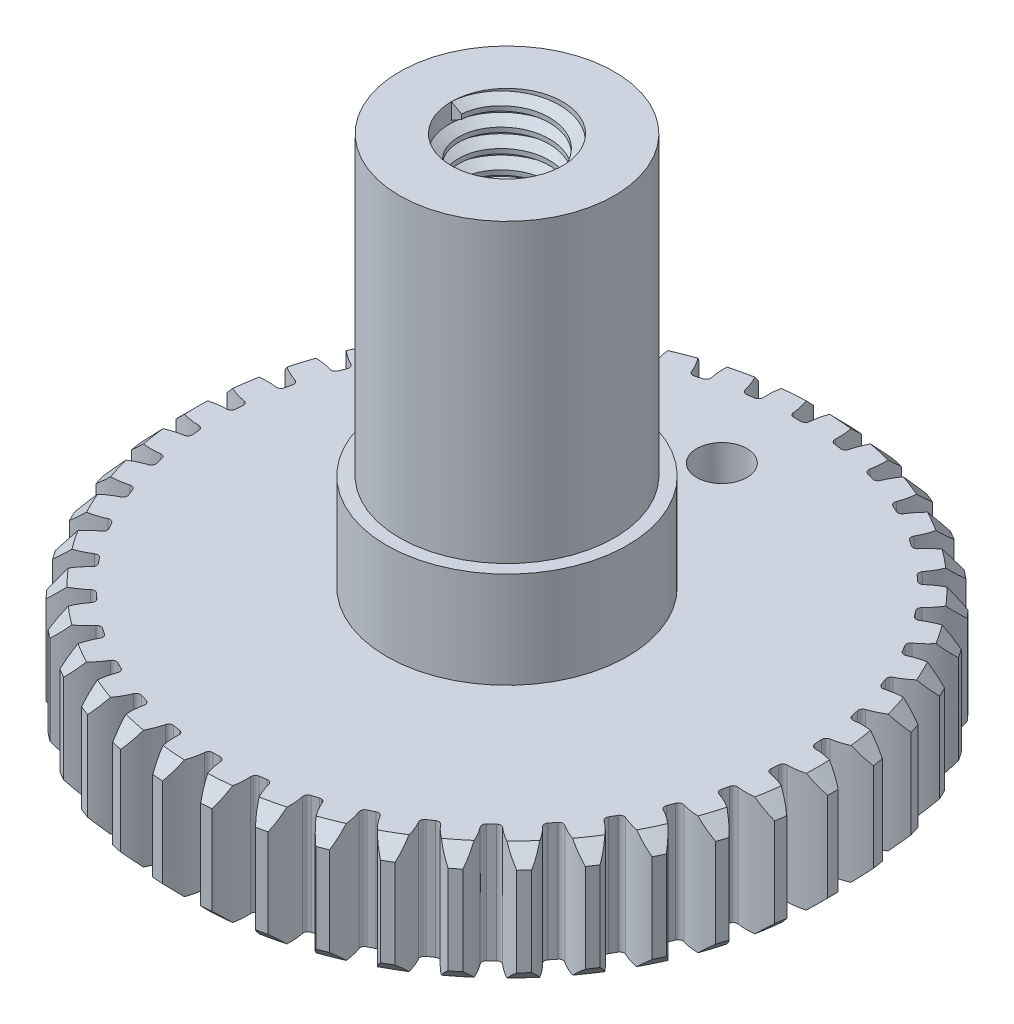
from build123d import *

# Parameters (mm, degrees)
SKETCH1_R                = 8.8
BOSS_EXTRUDE1_DEPTH      = 3.2
CUT_EXTRUDE1_DEPTH       = 13.849902723
FILLET2_R                = 0.12
CHAMFER1_SIZE            = 0.4
CIRPATTERN3_COUNT        = 42
FILLET2_OF_CIRPATTERN3_R = 0.12
SKETCH3_R                = 3.25
BOSS_EXTRUDE2_DEPTH      = 2.6
SKETCH4_R                = 2.9
SKETCH4_R_2              = 1.5
BOSS_EXTRUDE3_DEPTH      = 8
SKETCH5_R                = 6
BOSS_EXTRUDE4_DEPTH      = 0.9
SKETCH6_R                = 5
CUT_EXTRUDE2_DEPTH       = 2.6
SKETCH7_R                = 0.67838193
CUT_EXTRUDE3_DEPTH       = 17.339382575
SKETCH8_W                = 2
SKETCH8_H                = 5.2
CUT_EXTRUDE4_DEPTH       = 3
FILLET4_R                = 0.8
THREAD1_PITCH            = 0.5


with BuildPart() as part:
    # Sketch1 → Boss-Extrude1 (new body)
    with BuildSketch(Plane(origin=(0, 0, 0), x_dir=(1, 0, 0), z_dir=(0, 1, 0))):
        with Locations(Location((0, 0, 0), (0, 0, 270))):
            Circle(SKETCH1_R)
    extrude(amount=BOSS_EXTRUDE1_DEPTH)

    # Sketch2 → Cut-Extrude1 (cut, symmetric)
    with BuildSketch(Plane(origin=(0, 3.2, 0), x_dir=(1, 0, 0), z_dir=(0, 1, 0))):
        with BuildLine():
            ThreePointArc((-0.514373981, 8.784954149), (-0.292987988, 8.33266867), (-0.208076914, 7.836317965))
            ThreePointArc((-0.208076914, 7.836317965), (0, 7.83908), (0.208076914, 7.836317965))
            ThreePointArc((0.208076914, 7.836317965), (0.292987988, 8.33266867), (0.514373981, 8.784954149))
            ThreePointArc((0.514373981, 8.784954149), (0, 8.8), (-0.514373981, 8.784954149))
        make_face()
    cut_extrude1 = extrude(amount=CUT_EXTRUDE1_DEPTH, both=True, mode=Mode.SUBTRACT)

    # Fillet2
    fillet2_edges = [part.edges().sort_by_distance(p)[0] for p in [
        (0.208076914, 1.6, -7.836317965),
        (-0.208076914, 1.6, -7.836317965),
    ]]
    fillet(fillet2_edges, radius=FILLET2_R)

    # Chamfer1
    chamfer1_edges = [part.edges().sort_by_distance(p)[0] for p in [
        (-8.796237733, 0, 0.257296993),
        (-8.796237733, 3.2, 0.257296993),
    ]]
    chamfer(chamfer1_edges, length=CHAMFER1_SIZE)

    # CirPattern3: Cut-Extrude1 ×42 about axis
    cirpattern3_axis = Axis((0, 0, 0), (0, 1, 0))
    for i in range(1, CIRPATTERN3_COUNT):
        add(cut_extrude1.rotate(cirpattern3_axis, i * 360 / CIRPATTERN3_COUNT), mode=Mode.SUBTRACT)

    # Fillet2 of CirPattern3
    fillet2_of_cirpattern3_edges = [part.edges().sort_by_distance(p)[0] for p in [
        (-0.962189722, 1.6, -7.779805022),
        (-1.373695454, 1.6, -7.717780513),
        (-2.110962628, 1.6, -7.549504092),
        (-2.508627909, 1.6, -7.426840598),
        (-3.212580118, 1.6, -7.150559714),
        (-3.587521761, 1.6, -6.969997336),
        (-4.242433877, 1.6, -6.591883649),
        (-4.586276305, 1.6, -6.357455851),
        (-5.177518673, 1.6, -5.885955796),
        (-5.482581015, 1.6, -5.602899308),
        (-5.996946258, 1.6, -5.048545417),
        (-6.256413925, 1.6, -4.723183253),
        (-6.682411973, 1.6, -4.098358875),
        (-6.890488886, 1.6, -3.737959089),
        (-7.218603647, 1.6, -3.056621769),
        (-7.370641712, 1.6, -2.669235096),
        (-7.593543643, 1.6, -1.946604783),
        (-7.686146582, 1.6, -1.540884801),
        (-7.798856423, 1.6, -0.793103863),
        (-7.829955638, 1.6, -0.378113687),
        (-7.829955638, 1.6, 0.378113687),
        (-7.798856423, 1.6, 0.793103863),
        (-7.686146582, 1.6, 1.540884801),
        (-7.593543643, 1.6, 1.946604783),
        (-7.370641712, 1.6, 2.669235096),
        (-7.218603647, 1.6, 3.056621769),
        (-6.890488886, 1.6, 3.737959089),
        (-6.682411973, 1.6, 4.098358875),
        (-6.256413925, 1.6, 4.723183253),
        (-5.996946258, 1.6, 5.048545417),
        (-5.482581015, 1.6, 5.602899308),
        (-5.177518673, 1.6, 5.885955796),
        (-4.586276305, 1.6, 6.357455851),
        (-4.242433877, 1.6, 6.591883649),
        (-3.587521761, 1.6, 6.969997336),
        (-3.212580118, 1.6, 7.150559714),
        (-2.508627909, 1.6, 7.426840598),
        (-2.110962628, 1.6, 7.549504092),
        (-1.373695454, 1.6, 7.717780513),
        (-0.962189722, 1.6, 7.779805022),
        (-0.208076914, 1.6, 7.836317965),
        (0.208076914, 1.6, 7.836317965),
        (0.962189722, 1.6, 7.779805022),
        (1.373695454, 1.6, 7.717780513),
        (2.110962628, 1.6, 7.549504092),
        (2.508627909, 1.6, 7.426840598),
        (3.212580118, 1.6, 7.150559714),
        (3.587521761, 1.6, 6.969997336),
        (4.242433877, 1.6, 6.591883649),
        (4.586276305, 1.6, 6.357455851),
        (5.177518673, 1.6, 5.885955796),
        (5.482581015, 1.6, 5.602899308),
        (5.996946258, 1.6, 5.048545417),
        (6.256413925, 1.6, 4.723183253),
        (6.682411973, 1.6, 4.098358875),
        (6.890488886, 1.6, 3.737959089),
        (7.218603647, 1.6, 3.056621769),
        (7.370641712, 1.6, 2.669235096),
        (7.593543643, 1.6, 1.946604783),
        (7.686146582, 1.6, 1.540884801),
        (7.798856423, 1.6, 0.793103863),
        (7.829955638, 1.6, 0.378113687),
        (7.829955638, 1.6, -0.378113687),
        (7.798856423, 1.6, -0.793103863),
        (7.686146582, 1.6, -1.540884801),
        (7.593543643, 1.6, -1.946604783),
        (7.370641712, 1.6, -2.669235096),
        (7.218603647, 1.6, -3.056621769),
        (6.890488886, 1.6, -3.737959089),
        (6.682411973, 1.6, -4.098358875),
        (6.256413925, 1.6, -4.723183253),
        (5.996946258, 1.6, -5.048545417),
        (5.482581015, 1.6, -5.602899308),
        (5.177518673, 1.6, -5.885955796),
        (4.586276305, 1.6, -6.357455851),
        (4.242433877, 1.6, -6.591883649),
        (3.587521761, 1.6, -6.969997336),
        (3.212580118, 1.6, -7.150559714),
        (2.508627909, 1.6, -7.426840598),
        (2.110962628, 1.6, -7.549504092),
        (1.373695454, 1.6, -7.717780513),
        (0.962189722, 1.6, -7.779805022),
    ]]
    fillet(fillet2_of_cirpattern3_edges, radius=FILLET2_OF_CIRPATTERN3_R)

    # Sketch3 → Boss-Extrude2 (add)
    with BuildSketch(Plane(origin=(0, 3.2, 0), x_dir=(1, 0, 0), z_dir=(0, 1, 0))):
        with Locations(Location((0, 0, 0), (0, 0, 270))):
            Circle(SKETCH3_R)
    extrude(amount=BOSS_EXTRUDE2_DEPTH)

    # Sketch4 → Boss-Extrude3 (add)
    with BuildSketch(Plane(origin=(0, 5.8, 0), x_dir=(1, 0, 0), z_dir=(0, 1, 0))):
        with Locations(Location((0, 0, 0), (0, 0, 270))):
            Circle(SKETCH4_R)
        with Locations(Location((0, 0, 0), (0, 0, 270))):
            Circle(SKETCH4_R_2, mode=Mode.SUBTRACT)
    extrude(amount=BOSS_EXTRUDE3_DEPTH)

    # Sketch5 → Boss-Extrude4 (add)
    with BuildSketch(Plane(origin=(0, 0, 0), x_dir=(-1, 0, 0), z_dir=(0, -1, 0))):
        with Locations(Location((0, 0, 0), (0, 0, 270))):
            Circle(SKETCH5_R)
    extrude(amount=BOSS_EXTRUDE4_DEPTH)

    # Sketch6 → Cut-Extrude2 (cut)
    with BuildSketch(Plane(origin=(0, -0.9, 0), x_dir=(-1, 0, 0), z_dir=(0, -1, 0))):
        with Locations(Location((0, 0, 0), (0, 0, 90))):
            Circle(SKETCH6_R)
    extrude(amount=-CUT_EXTRUDE2_DEPTH, mode=Mode.SUBTRACT)

    # Sketch7 → Cut-Extrude3 (cut, through all)
    with BuildSketch(Plane(origin=(0, 3.2, 0), x_dir=(1, 0, 0), z_dir=(0, 1, 0))):
        with Locations(Location((0, 5.8, 0), (0, 0, 270))):
            Circle(SKETCH7_R)
    extrude(amount=-CUT_EXTRUDE3_DEPTH, mode=Mode.SUBTRACT)

    # Sketch8 → Cut-Extrude4 (cut)
    with BuildSketch(Plane(origin=(0, 1.7, 0), x_dir=(-1, 0, 0), z_dir=(0, -1, 0))):
        Rectangle(SKETCH8_W, SKETCH8_H)
    extrude(amount=-CUT_EXTRUDE4_DEPTH, mode=Mode.SUBTRACT)

    # Fillet4
    fillet4_edges = [part.edges().sort_by_distance(p)[0] for p in [
        (-1, 3.2, -2.6),
        (-1, 3.2, 2.6),
        (1, 3.2, 2.6),
        (1, 3.2, -2.6),
    ]]
    fillet(fillet4_edges, radius=FILLET4_R)

    # Thread1: the profile of Thread Profile1 profile screwed along a right-hand helix of 16 turns, 6 arcs to a turn; built about Z, then put on its axis
    thread1_z = Axis((0, 0, 0), (0, 0, 1))
    thread1_corners = [(1.5003, 0, -0.000173205), (1.5003, 0, 0.437673204), (1.229367063, 0, 0.281249999), (1.229367063, 0, 0.156249999)]
    with BuildLine(mode=Mode.PRIVATE) as thread1_profile:
        Line(thread1_corners[0], thread1_corners[1])
        Line(thread1_corners[1], thread1_corners[2])
        Line(thread1_corners[2], thread1_corners[3])
        Line(thread1_corners[3], thread1_corners[0])
    thread1_cap = Face(thread1_profile.wire())
    thread1_turn_angles = [0, 30, 60, 90, 120, 150, 180, 210, 240, 270, 300, 330, 360]
    thread1_turn_weights = [1, 0.8660254037844387, 1, 0.8660254037844387, 1, 0.8660254037844387, 1, 0.8660254037844387, 1, 0.8660254037844387, 1, 0.8660254037844387, 1]
    thread1_turn_rails = [Edge.make_bspline([Vector(p[0], p[1], 0).rotate(thread1_z, thread1_turn_angles[k]) / thread1_turn_weights[k] + Vector(0, 0, p[2] + THREAD1_PITCH * thread1_turn_angles[k] / 360) for k in range(13)], [0, 0, 0, 1, 1, 2, 2, 3, 3, 4, 4, 5, 5, 6, 6, 6], 2, thread1_turn_weights) for p in thread1_corners]
    thread1_turn_sides = [Face.make_surface_from_curves(thread1_turn_rails[p[0]], thread1_turn_rails[p[1]]) for p in [(0, 1), (1, 2), (2, 3), (3, 0)]]
    thread1 = Plane(origin=(0, 13.8, 0), x_dir=(-1, 0, 0), z_dir=(0, -1, 0)) * Solid(Shell([*[p.moved(Location((0, 0, THREAD1_PITCH * i))) for i in range(16) for p in thread1_turn_sides], thread1_cap, thread1_cap.rotate(thread1_z, 5760).moved(Location((0, 0, THREAD1_PITCH * 5760 / 360)))]))
    add(thread1)


solid = part.part
